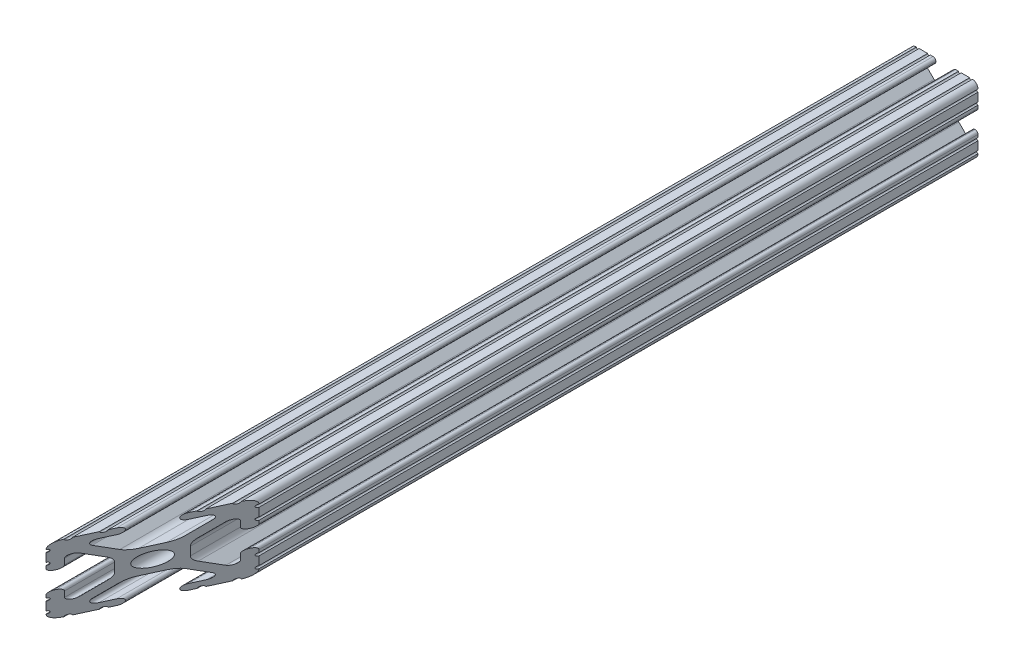
from build123d import *

# Parameters (mm, degrees)
SKETCH1_R           = 2.6035
BOSS_EXTRUDE1_DEPTH = 190.5
CUT_EXTRUDE1_DEPTH  = 193.605036279


with BuildPart() as part:
    # Sketch1 → Boss-Extrude1 (new, symmetric)
    with BuildSketch(Plane.XY):
        with BuildLine():
            Line((-7.179650497, -8.645192506), (-3.952270251, -5.423690499))
            ThreePointArc((-3.952270251, -5.423690499), (-2.922936451, -4.736929036), (-1.709253557, -4.4958))
            Line((-1.709253557, -4.4958), (1.709253557, -4.4958))
            ThreePointArc((1.709253557, -4.4958), (2.922936451, -4.736929036), (3.952270251, -5.423690499))
            Line((3.952270251, -5.423690499), (7.179650497, -8.645192506))
            ThreePointArc((7.179650497, -8.645192506), (7.41473083, -9.822813117), (6.416408329, -10.4902))
            Line((6.416408329, -10.4902), (4.287512407, -10.4902))
            ThreePointArc((4.287512407, -10.4902), (3.54574862, -10.79744862), (3.2385, -11.539212407))
            Line((3.2385, -11.539212407), (3.2385, -11.650987593))
            ThreePointArc((3.2385, -11.650987593), (3.54574862, -12.39275138), (4.287512407, -12.7))
            Line((4.287512407, -12.7), (5.317126718, -12.7))
            ThreePointArc((5.317126718, -12.7), (5.825126718, -12.192), (6.333126718, -12.7))
            Line((6.333126718, -12.7), (9.550443118, -12.7))
            ThreePointArc((9.550443118, -12.7), (10.058366869, -12.192000006), (10.566443095, -12.699847501))
            ThreePointArc((10.566443095, -12.699847501), (12.082537762, -12.08250727), (12.699846982, -10.566399977))
            ThreePointArc((12.699846982, -10.566399977), (12.192000006, -10.058323491), (12.7, -9.5504))
            Line((12.7, -9.5504), (12.7, -6.3330836))
            ThreePointArc((12.7, -6.3330836), (12.192, -5.8250836), (12.7, -5.3170836))
            Line((12.7, -5.3170836), (12.7, -4.287469289))
            ThreePointArc((12.7, -4.287469289), (12.39275138, -3.545705502), (11.650987593, -3.238456882))
            Line((11.650987593, -3.238456882), (11.539212407, -3.238456882))
            ThreePointArc((11.539212407, -3.238456882), (10.79744862, -3.545705502), (10.4902, -4.287469289))
            Line((10.4902, -4.287469289), (10.4902, -6.402089023))
            ThreePointArc((10.4902, -6.402089023), (9.856505071, -7.351067942), (8.737131347, -7.129408934))
            Line((8.737131347, -7.129408934), (5.441005833, -3.840816462))
            ThreePointArc((5.441005833, -3.840816462), (4.750877967, -2.809883091), (4.5085, -1.593185507))
            Line((4.5085, -1.593185507), (4.5085, 1.593185507))
            ThreePointArc((4.5085, 1.593185507), (4.750877967, 2.809883091), (5.441005833, 3.840816462))
            Line((5.441005833, 3.840816462), (8.737131347, 7.129408934))
            ThreePointArc((8.737131347, 7.129408934), (9.856505071, 7.351067942), (10.4902, 6.402089023))
            Line((10.4902, 6.402089023), (10.4902, 4.287469289))
            ThreePointArc((10.4902, 4.287469289), (10.79744862, 3.545705502), (11.539212407, 3.238456882))
            Line((11.539212407, 3.238456882), (11.650987593, 3.238456882))
            ThreePointArc((11.650987593, 3.238456882), (12.39275138, 3.545705502), (12.7, 4.287469289))
            Line((12.7, 4.287469289), (12.7, 5.3170836))
            ThreePointArc((12.7, 5.3170836), (12.192, 5.8250836), (12.7, 6.3330836))
            Line((12.7, 6.3330836), (12.7, 9.5504))
            ThreePointArc((12.7, 9.5504), (12.192000006, 10.058323491), (12.699846982, 10.566399977))
            ThreePointArc((12.699846982, 10.566399977), (12.082537762, 12.08250727), (10.566443095, 12.699847501))
            ThreePointArc((10.566443095, 12.699847501), (10.058366869, 12.192000006), (9.550443118, 12.7))
            Line((9.550443118, 12.7), (6.333126718, 12.7))
            ThreePointArc((6.333126718, 12.7), (5.825126718, 12.192), (5.317126718, 12.7))
            Line((5.317126718, 12.7), (4.287512407, 12.7))
            ThreePointArc((4.287512407, 12.7), (3.54574862, 12.39275138), (3.2385, 11.650987593))
            Line((3.2385, 11.650987593), (3.2385, 11.539212407))
            ThreePointArc((3.2385, 11.539212407), (3.54574862, 10.79744862), (4.287512407, 10.4902))
            Line((4.287512407, 10.4902), (6.476788598, 10.4902))
            ThreePointArc((6.476788598, 10.4902), (7.432222385, 9.85140422), (7.207036008, 8.724370562))
            Line((7.207036008, 8.724370562), (3.898272566, 5.423169045))
            ThreePointArc((3.898272566, 5.423169045), (2.869120213, 4.736787962), (1.655778399, 4.4958))
            Line((1.655778399, 4.4958), (-1.655778399, 4.4958))
            ThreePointArc((-1.655778399, 4.4958), (-2.869120213, 4.736787962), (-3.898272566, 5.423169045))
            Line((-3.898272566, 5.423169045), (-7.207036008, 8.724370562))
            ThreePointArc((-7.207036008, 8.724370562), (-7.432222385, 9.85140422), (-6.476788598, 10.4902))
            Line((-6.476788598, 10.4902), (-4.287512407, 10.4902))
            ThreePointArc((-4.287512407, 10.4902), (-3.54574862, 10.79744862), (-3.2385, 11.539212407))
            Line((-3.2385, 11.539212407), (-3.2385, 11.650987593))
            ThreePointArc((-3.2385, 11.650987593), (-3.54574862, 12.39275138), (-4.287512407, 12.7))
            Line((-4.287512407, 12.7), (-5.317126718, 12.7))
            ThreePointArc((-5.317126718, 12.7), (-5.825126718, 12.192), (-6.333126718, 12.7))
            Line((-6.333126718, 12.7), (-9.550443118, 12.7))
            ThreePointArc((-9.550443118, 12.7), (-10.058366869, 12.192000006), (-10.566443095, 12.699847501))
            ThreePointArc((-10.566443095, 12.699847501), (-12.082537762, 12.08250727), (-12.699846982, 10.566399977))
            ThreePointArc((-12.699846982, 10.566399977), (-12.192000006, 10.058323491), (-12.7, 9.5504))
            Line((-12.7, 9.5504), (-12.7, 6.3330836))
            ThreePointArc((-12.7, 6.3330836), (-12.192, 5.8250836), (-12.7, 5.3170836))
            Line((-12.7, 5.3170836), (-12.7, 4.287469289))
            ThreePointArc((-12.7, 4.287469289), (-12.39275138, 3.545705502), (-11.650987593, 3.238456882))
            Line((-11.650987593, 3.238456882), (-11.539212407, 3.238456882))
            ThreePointArc((-11.539212407, 3.238456882), (-10.79744862, 3.545705502), (-10.4902, 4.287469289))
            Line((-10.4902, 4.287469289), (-10.4902, 6.402089023))
            ThreePointArc((-10.4902, 6.402089023), (-9.856505071, 7.351067942), (-8.737131347, 7.129408934))
            Line((-8.737131347, 7.129408934), (-5.441005833, 3.840816462))
            ThreePointArc((-5.441005833, 3.840816462), (-4.750877967, 2.809883091), (-4.5085, 1.593185507))
            Line((-4.5085, 1.593185507), (-4.5085, -1.593185507))
            ThreePointArc((-4.5085, -1.593185507), (-4.750877967, -2.809883091), (-5.441005833, -3.840816462))
            Line((-5.441005833, -3.840816462), (-8.737131347, -7.129408934))
            ThreePointArc((-8.737131347, -7.129408934), (-9.856505071, -7.351067942), (-10.4902, -6.402089023))
            Line((-10.4902, -6.402089023), (-10.4902, -4.287469289))
            ThreePointArc((-10.4902, -4.287469289), (-10.79744862, -3.545705502), (-11.539212407, -3.238456882))
            Line((-11.539212407, -3.238456882), (-11.650987593, -3.238456882))
            ThreePointArc((-11.650987593, -3.238456882), (-12.39275138, -3.545705502), (-12.7, -4.287469289))
            Line((-12.7, -4.287469289), (-12.7, -5.3170836))
            ThreePointArc((-12.7, -5.3170836), (-12.192, -5.8250836), (-12.7, -6.3330836))
            Line((-12.7, -6.3330836), (-12.7, -9.5504))
            ThreePointArc((-12.7, -9.5504), (-12.192000006, -10.058323491), (-12.699846982, -10.566399977))
            ThreePointArc((-12.699846982, -10.566399977), (-12.082537762, -12.08250727), (-10.566443095, -12.699847501))
            ThreePointArc((-10.566443095, -12.699847501), (-10.058366869, -12.192000006), (-9.550443118, -12.7))
            Line((-9.550443118, -12.7), (-6.333126718, -12.7))
            ThreePointArc((-6.333126718, -12.7), (-5.825126718, -12.192), (-5.317126718, -12.7))
            Line((-5.317126718, -12.7), (-4.287512407, -12.7))
            ThreePointArc((-4.287512407, -12.7), (-3.54574862, -12.39275138), (-3.2385, -11.650987593))
            Line((-3.2385, -11.650987593), (-3.2385, -11.539212407))
            ThreePointArc((-3.2385, -11.539212407), (-3.54574862, -10.79744862), (-4.287512407, -10.4902))
            Line((-4.287512407, -10.4902), (-6.416408329, -10.4902))
            ThreePointArc((-6.416408329, -10.4902), (-7.41473083, -9.822813117), (-7.179650497, -8.645192506))
        make_face()
        Circle(SKETCH1_R, mode=Mode.SUBTRACT)
    extrude(amount=BOSS_EXTRUDE1_DEPTH, both=True)

    # Sketch2 → Cut-Extrude1 (cut, through all)
    with BuildSketch(Plane(origin=(0, 12.7, 0), x_dir=(1, 0, 0), z_dir=(0, 1, 0))):
        Polygon((12.7, -190.5), (-12.7, -190.5), (-12.7, -136.209875529), (12.7, -81.096667981), align=None)
    extrude(amount=-CUT_EXTRUDE1_DEPTH, mode=Mode.SUBTRACT)


solid = part.part
